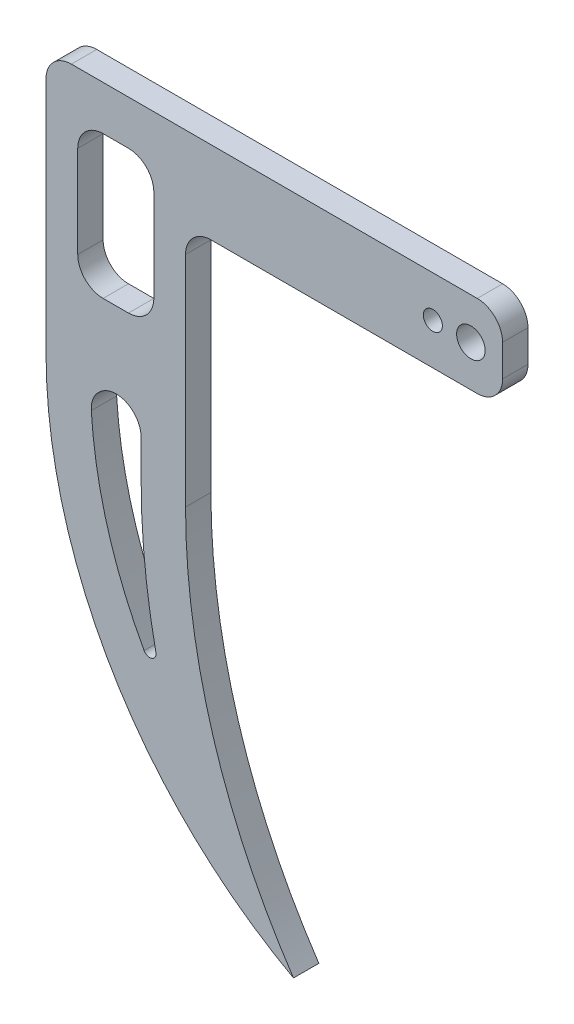
from build123d import *

# Parameters (mm, degrees)
ESQUISSE1_W             = 12
ESQUISSE1_H             = 22.5
BOSS_EXTRU_1_DEPTH      = 4
ENL_V_MAT_EXTRU_1_DEPTH = 94.445721179
SKETCH1_W               = 50
SKETCH1_H               = 13
BOSS_EXTRUDE1_DEPTH     = 4
SKETCH2_R               = 2.25
SKETCH2_R_2             = 1.5
CUT_EXTRUDE1_DEPTH      = 4
FILLET1_R               = 4
FILLET2_R               = 1


with BuildPart() as part:
    # Esquisse1 → Boss.-Extru.1 (new body)
    with BuildSketch(Plane.XY):
        with BuildLine():
            Line((-11, -18.25), (-11, 18.25))
            Line((-11, 18.25), (11, 18.25))
            Line((11, 18.25), (11, -18.25))
            Line((11, -18.25), (11, -33.25))
            ThreePointArc((11, -33.25), (15.349591107, -62.421891926), (28.019985571, -89.056067818))
            ThreePointArc((28.019985571, -89.056067818), (-0.511631053, -61.502443829), (-11, -23.25))
            Line((-11, -23.25), (-11, -18.25))
        make_face()
        Rectangle(ESQUISSE1_W, ESQUISSE1_H, mode=Mode.SUBTRACT)
    extrude(amount=BOSS_EXTRU_1_DEPTH)

    # Esquisse2 → Enlèv. mat.-Extru.1 (cut, through all)
    with BuildSketch(Plane.XY.offset(4)):
        with BuildLine():
            Line((-4, -23.25), (4, -23.25))
            Line((4, -23.25), (4, -33.25))
            ThreePointArc((4, -33.25), (4.956601419, -47.525770288), (7.809301258, -61.546284087))
            ThreePointArc((7.809301258, -61.546284087), (-0.980641404, -43.287870216), (-4, -23.25))
        make_face()
    extrude(amount=-ENL_V_MAT_EXTRU_1_DEPTH, mode=Mode.SUBTRACT)

    # Sketch1 → Boss-Extrude1 (add)
    with BuildSketch(Plane.XY.offset(4)):
        with Locations((36, 11.75)):
            Rectangle(SKETCH1_W, SKETCH1_H)
    extrude(amount=-BOSS_EXTRUDE1_DEPTH)

    # Sketch2 → Cut-Extrude1 (cut)
    with BuildSketch(Plane.XY.offset(4)):
        with Locations((56, 11.75)):
            Circle(SKETCH2_R)
        with Locations((50, 11.75)):
            Circle(SKETCH2_R_2)
    extrude(amount=-CUT_EXTRUDE1_DEPTH, mode=Mode.SUBTRACT)

    # Fillet1
    # the kernel refuses this fillet: 4 mm, written as the material it adds along each edge
    with BuildSketch(Plane(origin=(11, 5.25, 4), x_dir=(0, -1, 0), z_dir=(0, 0, -1)), Plane(origin=(4, -23.25, 4), x_dir=(-1, 0, 0), z_dir=(0, 0, -1)), Plane(origin=(6, -11.25, 0), x_dir=(-1, 0, 0), z_dir=(0, 0, 1)), Plane(origin=(6, 11.25, 0), x_dir=(0, -1, 0), z_dir=(0, 0, 1))) as fillet1_piece_1:
        with BuildLine():
            CenterArc((FILLET1_R, -FILLET1_R), FILLET1_R, 90, 90)
            Line((0, -FILLET1_R), (0, 0))
            Line((0, 0), (FILLET1_R, 0))
        make_face()
    extrude(amount=4)
    with BuildSketch(Plane(origin=(-4, -23.25, 4), x_dir=(1, 0, 0), z_dir=(0, 0, -1))) as fillet1_piece_2:
        with BuildLine():
            CenterArc((4.125122309, 4), FILLET1_R, 176.416678302, 93.583321698)
            ThreePointArc((0.132942454, 4.25), (0.033243739, 2.126039375), (0, 0))
            Line((0, 0), (4.125122309, 0))
        make_face()
    extrude(amount=4)
    with BuildSketch(Plane(origin=(-6, -11.25, 0), x_dir=(1, 0, 0), z_dir=(0, 0, 1)), Plane(origin=(-6, 11.25, 0), x_dir=(0, -1, 0), z_dir=(0, 0, 1))) as fillet1_piece_3:
        with BuildLine():
            CenterArc((FILLET1_R, FILLET1_R), FILLET1_R, 180, 90)
            Line((0, FILLET1_R), (0, 0))
            Line((0, 0), (FILLET1_R, 0))
        make_face()
    extrude(amount=4)
    # the kernel refuses this fillet: 4 mm, written as the material it takes off along each edge
    with BuildSketch(Plane(origin=(-11, 18.25, -10), x_dir=(0, -1, 0), z_dir=(0, 0, 1))) as fillet1_2_piece_1:
        with BuildLine():
            CenterArc((FILLET1_R, FILLET1_R), FILLET1_R, 180, 90)
            Line((0, FILLET1_R), (0, 0))
            Line((0, 0), (FILLET1_R, 0))
        make_face()
    extrude(amount=24, mode=Mode.SUBTRACT)
    with BuildSketch(Plane(origin=(61, 5.25, 14), x_dir=(0, 1, 0), z_dir=(0, 0, -1)), Plane(origin=(61, 18.25, 14), x_dir=(-1, 0, 0), z_dir=(0, 0, -1))) as fillet1_2_piece_2:
        with BuildLine():
            CenterArc((FILLET1_R, -FILLET1_R), FILLET1_R, 90, 90)
            Line((0, -FILLET1_R), (0, 0))
            Line((0, 0), (FILLET1_R, 0))
        make_face()
    extrude(amount=24, mode=Mode.SUBTRACT)

    # Fillet2
    fillet2_edges = [part.edges().sort_by_distance(p)[0] for p in [
        (7.809301258, -61.546284087, 2),
    ]]
    fillet(fillet2_edges, radius=FILLET2_R)


solid = part.part
